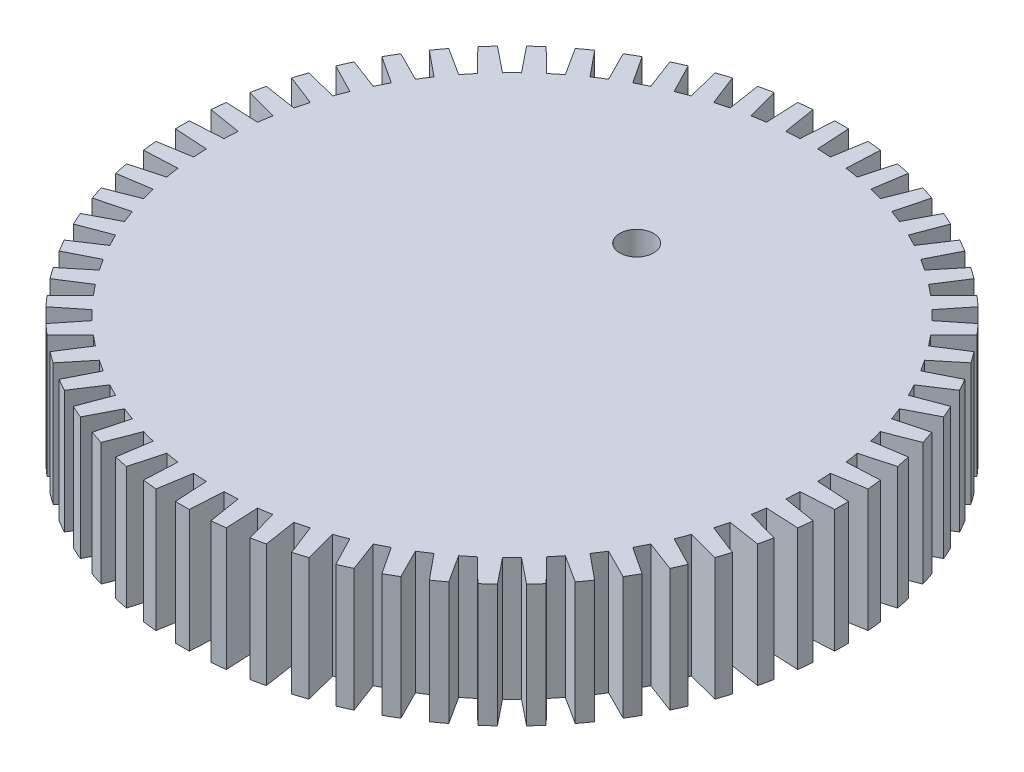
from build123d import *

# Parameters (mm, degrees)
SKETCH1_R                 = 30.25
BOSS_EXTRUDE2_DEPTH       = 12.5
BOSS_EXTRUDE3_START       = -12.5
BOSS_EXTRUDE3_DEPTH       = 12.5
CIRPATTERN1_COUNT         = 60
F_8_32_TAPPED_HOLE1_D     = 3.4544
F_8_32_TAPPED_HOLE1_DEPTH = 10
F_8_32_TAPPED_HOLE1_TIP   = 1.037806461


with BuildPart() as part:
    # Sketch1 → Boss-Extrude2 (new body)
    with BuildSketch(Plane(origin=(0, 0, 0), x_dir=(1, 0, 0), z_dir=(0, 1, 0))):
        with Locations(Location((0, 0, 0), (0, 0, 270))):
            Circle(SKETCH1_R)
    extrude(amount=BOSS_EXTRUDE2_DEPTH)

    # Sketch5 → Boss-Extrude3 (add)
    with BuildSketch(Plane(origin=(0, 12.5, 0), x_dir=(1, 0, 0), z_dir=(0, 1, 0)).offset(BOSS_EXTRUDE3_START)):
        with BuildLine():
            Line((0.9, 30.236608606), (0.707741941, 33.575958915))
            ThreePointArc((0.707741941, 33.575958915), (0, 33.583417273), (-0.707741941, 33.575958915))
            Line((-0.707741941, 33.575958915), (-0.9, 30.236608606))
            ThreePointArc((-0.9, 30.236608606), (0, 30.25), (0.9, 30.236608606))
        make_face()
    boss_extrude3 = extrude(amount=BOSS_EXTRUDE3_DEPTH)

    # CirPattern1: Boss-Extrude3 ×60 about axis
    cirpattern1_axis = Axis((0, 0, 0), (0, 1, 0))
    for i in range(1, CIRPATTERN1_COUNT):
        add(boss_extrude3.rotate(cirpattern1_axis, i * 360 / CIRPATTERN1_COUNT))

    # #8-32 Tapped Hole1
    with Locations(Plane(origin=(0, 12.5, 0), x_dir=(1, 0, 0), z_dir=(0, 1, 0))):
        with Locations((0, 12.7)):
            Hole(F_8_32_TAPPED_HOLE1_D / 2, depth=F_8_32_TAPPED_HOLE1_DEPTH)
            with Locations((0, 0, -(F_8_32_TAPPED_HOLE1_DEPTH + F_8_32_TAPPED_HOLE1_TIP / 2))):  # 118° drill point
                Cone(0, F_8_32_TAPPED_HOLE1_D / 2, F_8_32_TAPPED_HOLE1_TIP, mode=Mode.SUBTRACT)


solid = part.part
